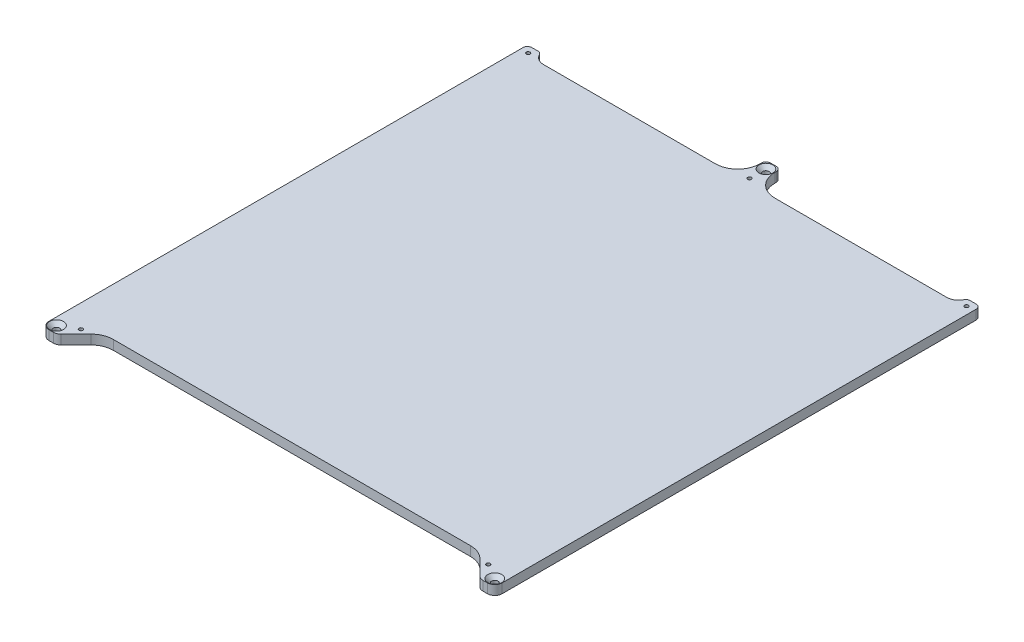
from build123d import *

# Parameters (mm, degrees)
BOSS_EXTRUDE1_DEPTH                             = 6.35
CSK_FOR_M4_FLAT_HEAD_MACHINE_SCREW1_D           = 4.3
CSK_FOR_M4_FLAT_HEAD_MACHINE_SCREW1_CSINK_D     = 9.4
CSK_FOR_M4_FLAT_HEAD_MACHINE_SCREW1_CSINK_ANGLE = 90
CHAMFER1_SIZE                                   = 16
FILLET4_R                                       = 15
SKETCH6_W                                       = 10
SKETCH6_H                                       = 6
BOSS_EXTRUDE2_DEPTH                             = 6.35
FILLET2_R                                       = 3
FILLET5_R                                       = 8
M3X0_5_TAPPED_HOLE1_D                           = 2.5
FILLET6_START                                   = -1
FILLET6_DEPTH                                   = 8


with BuildPart() as part:
    # Sketch1 → Boss-Extrude1 (new body)
    with BuildSketch(Plane(origin=(0, 0, 0), x_dir=(1, 0, 0), z_dir=(0, 1, 0))):
        Polygon((-5, 171.5), (5, 171.5), (5, 152.5), (152.5, 152.5), (152.5, -168.5), (142.5, -168.5), (142.5, -152.5), (-142.5, -152.5), (-142.5, -168.5), (-152.5, -168.5), (-152.5, 152.5), (-5, 152.5), align=None)
    extrude(amount=BOSS_EXTRUDE1_DEPTH)

    # CSK for M4 Flat Head Machine Screw1 (through all)
    with Locations(Plane(origin=(0, 6.35, 0), x_dir=(1, 0, 0), z_dir=(0, 1, 0))):
        with Locations((0, 166.5), (-147.5, -163.5), (147.5, -163.5)):
            CounterSinkHole(CSK_FOR_M4_FLAT_HEAD_MACHINE_SCREW1_D / 2, CSK_FOR_M4_FLAT_HEAD_MACHINE_SCREW1_CSINK_D / 2, counter_sink_angle=CSK_FOR_M4_FLAT_HEAD_MACHINE_SCREW1_CSINK_ANGLE)

    # Chamfer1
    chamfer1_edges = [part.edges().sort_by_distance(p)[0] for p in [
        (142.5, 3.175, 152.5),
        (-142.5, 3.175, 152.5),
    ]]
    chamfer(chamfer1_edges, length=CHAMFER1_SIZE - 0.0001)  # a hair under: the kernel refuses the full size

    # Fillet4
    fillet4_edges = [part.edges().sort_by_distance(p)[0] for p in [
        (-5, 3.175, -152.5),
        (5, 3.175, -152.5),
        (-126.5001, 3.175, 152.5),
        (126.5001, 3.175, 152.5),
    ]]
    fillet(fillet4_edges, radius=FILLET4_R)

    # Sketch6 → Boss-Extrude2 (add)
    with BuildSketch(Plane(origin=(0, 6.35, 0), x_dir=(1, 0, 0), z_dir=(0, 1, 0))):
        with Locations((-147.5, 155.5)):
            Rectangle(SKETCH6_W, SKETCH6_H)
        with Locations((147.5, 155.5)):
            Rectangle(SKETCH6_W, SKETCH6_H)
    extrude(amount=-BOSS_EXTRUDE2_DEPTH)

    # Fillet2
    fillet2_edges = [part.edges().sort_by_distance(p)[0] for p in [
        (142.5, 3.175, -158.5),
        (152.5, 3.175, -158.5),
        (-5, 3.175, -171.5),
        (5, 3.175, -171.5),
        (-142.5, 3.175, -158.5),
        (-152.5, 3.175, -158.5),
    ]]
    fillet(fillet2_edges, radius=FILLET2_R)

    # Fillet5
    fillet5_edges = [part.edges().sort_by_distance(p)[0] for p in [
        (142.5, 3.175, -152.5),
        (-142.5, 3.175, -152.5),
    ]]
    fillet(fillet5_edges, radius=FILLET5_R)

    # M3x0.5 Tapped Hole1 (through all)
    with Locations(Plane(origin=(0, 6.35, 0), x_dir=(1, 0, 0), z_dir=(0, 1, 0))):
        with Locations((-147.5, 154), (147.5, 154), (137.107695155, -157.5), (-137.107695155, -157.5), (0, 155.5)):
            Hole(M3X0_5_TAPPED_HOLE1_D / 2)

    # Fillet6: read off the stored shape, not the designer's step
    # Fillet6 outline → Fillet6 (cut)
    with BuildSketch(Plane(origin=(0, 0, 0), x_dir=(1, 0, 0), z_dir=(0, 1, 0)).offset(FILLET6_START)):
        with BuildLine():
            ThreePointArc((152.5, -163.5), (151.035533906, -167.035533906), (147.5, -168.5))
            Line((147.5, -168.5), (152.5, -168.5))
            Line((152.5, -168.5), (152.5, -163.5))
        make_face()
        with BuildLine():
            ThreePointArc((144.571067812, -168.5), (142.65765065, -168.119397663), (141.035533906, -167.035533906))
            Line((141.035533906, -167.035533906), (142.5, -168.5))
            Line((142.5, -168.5), (144.571067812, -168.5))
        make_face()
        with BuildLine():
            ThreePointArc((-141.035533906, -167.035533906), (-142.65765065, -168.119397663), (-144.571067812, -168.5))
            Line((-144.571067812, -168.5), (-142.5, -168.5))
            Line((-142.5, -168.5), (-141.035533906, -167.035533906))
        make_face()
        with BuildLine():
            Line((-152.5, -168.5), (-147.5, -168.5))
            ThreePointArc((-147.5, -168.5), (-151.035533906, -167.035533906), (-152.5, -163.5))
            Line((-152.5, -163.5), (-152.5, -168.5))
        make_face()
    extrude(amount=FILLET6_DEPTH, mode=Mode.SUBTRACT)


solid = part.part
